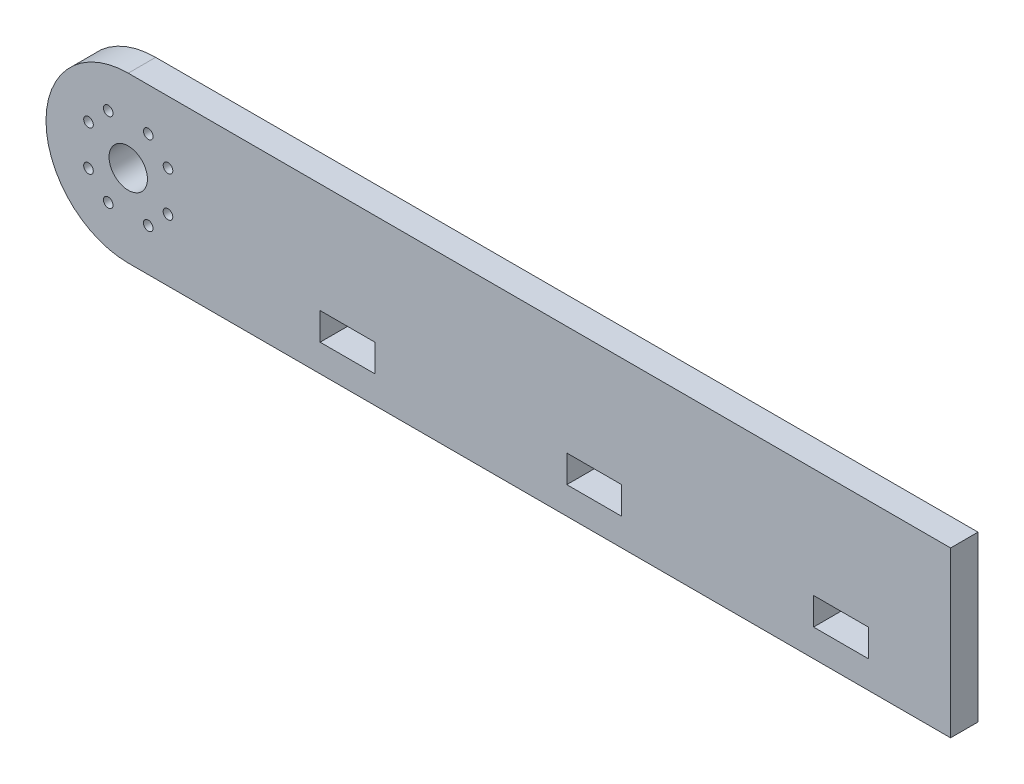
from build123d import *

# Parameters (mm, degrees)
ESQUISSE1_R        = 0.875
ESQUISSE1_W        = 10
ESQUISSE1_H        = 5
ESQUISSE1_R_2      = 3.5
BOSS_EXTRU_1_DEPTH = 5


with BuildPart() as part:
    # Esquisse1 → Boss.-Extru.1 (new body)
    with BuildSketch(Plane.XY):
        with BuildLine():
            Line((150, 15), (0, 15))
            ThreePointArc((0, 15), (-15, 0), (0, -15))
            Line((0, -15), (150, -15))
            Line((150, -15), (150, 15))
        make_face()
        with Locations((-3.65, -7.25)):
            Circle(ESQUISSE1_R, mode=Mode.SUBTRACT)
        with Locations((3.65, -7.25)):
            Circle(ESQUISSE1_R, mode=Mode.SUBTRACT)
        with Locations((-7.25, -3.65)):
            Circle(ESQUISSE1_R, mode=Mode.SUBTRACT)
        with Locations((7.25, -3.65)):
            Circle(ESQUISSE1_R, mode=Mode.SUBTRACT)
        with Locations((40, -7.5)):
            Rectangle(ESQUISSE1_W, ESQUISSE1_H, mode=Mode.SUBTRACT)
        with Locations((85, -7.5)):
            Rectangle(ESQUISSE1_W, ESQUISSE1_H, mode=Mode.SUBTRACT)
        with Locations((130, -7.5)):
            Rectangle(ESQUISSE1_W, ESQUISSE1_H, mode=Mode.SUBTRACT)
        Circle(ESQUISSE1_R_2, mode=Mode.SUBTRACT)
        with Locations((-7.25, 3.65)):
            Circle(ESQUISSE1_R, mode=Mode.SUBTRACT)
        with Locations((7.25, 3.65)):
            Circle(ESQUISSE1_R, mode=Mode.SUBTRACT)
        with Locations((-3.65, 7.25)):
            Circle(ESQUISSE1_R, mode=Mode.SUBTRACT)
        with Locations((3.65, 7.25)):
            Circle(ESQUISSE1_R, mode=Mode.SUBTRACT)
    extrude(amount=BOSS_EXTRU_1_DEPTH)


solid = part.part
